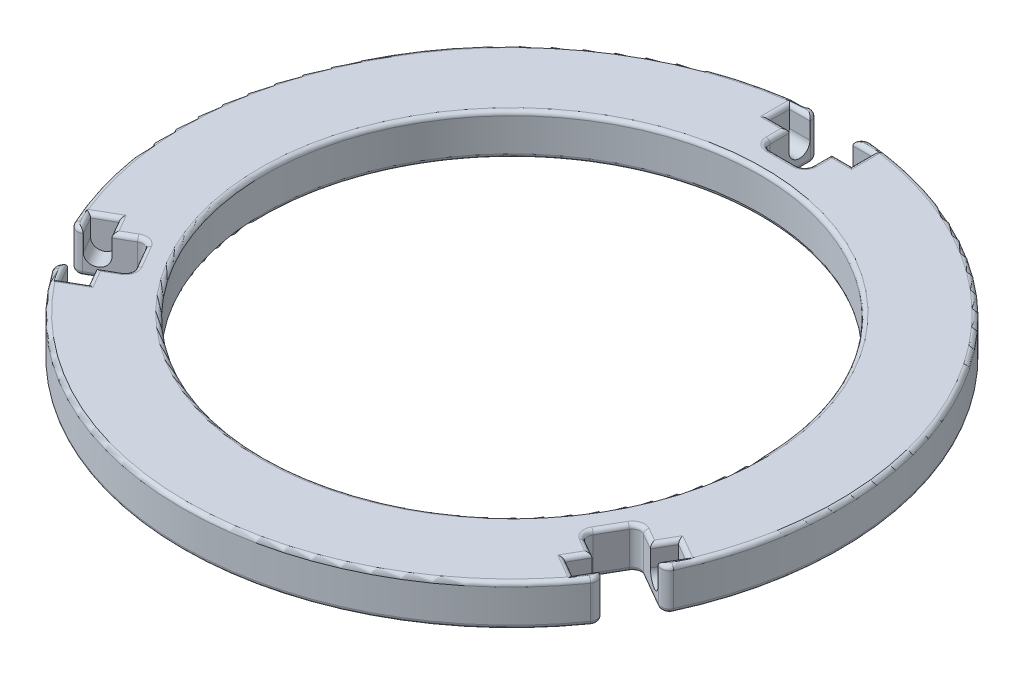
from build123d import *

# Parameters (mm, degrees)
SKETCH1_R           = 60.125027824228184
BOSS_EXTRUDE1_DEPTH = 10
CUT_EXTRUDE2_START  = -5
CUT_EXTRUDE2_DEPTH  = 20.2
CIRPATTERN1_COUNT   = 3
FILLET3_R           = 1


with BuildPart() as part:
    # Sketch1 → Boss-Extrude1 (new body)
    with BuildSketch(Plane(origin=(0, 0, 0), x_dir=(1, 0, 0), z_dir=(0, 1, 0))):
        with BuildLine():
            Line((0, 65.8865619392777), (-3.1999999999999855, 65.8865619392777))
            ThreePointArc((-3.1999999999999855, 65.8865619392777), (-4.614213562373095, 66.4723483769046), (-5.2, 67.88656193927771))
            Line((-5.2, 67.88656193927771), (-5.2, 77.66698140136515))
            ThreePointArc((-5.2, 77.66698140136515), (-5.85263790487315, 79.14502584745443), (-7.384615384615385, 79.65844246293861))
            ThreePointArc((-7.384615384615385, 79.65844246293861), (-69.28203230275511, 39.999999999999964), (-72.67854249111355, -33.433956711215025))
            ThreePointArc((-72.67854249111355, -33.433956711215025), (-71.46792191950811, -34.50397981895536), (-69.86157892883573, -34.33015860100353))
            Line((-69.86157892883573, -34.33015860100353), (-61.39148721500026, -29.439948869959796))
            ThreePointArc((-61.39148721500026, -29.439948869959796), (-59.87384912479522, -29.240148024950535), (-58.659436407431386, -30.17199967752867))
            Line((-58.659436407431386, -30.17199967752867), (-57.05943640743138, -32.94328096963888))
            Line((-57.05943640743138, -32.94328096963888), (-55.459436407431376, -35.71456226174908))
            ThreePointArc((-55.459436407431376, -35.71456226174908), (-55.25963556242212, -37.23220035195412), (-56.19148721500025, -38.446613069317955))
            Line((-56.19148721500025, -38.446613069317955), (-64.66157892883571, -43.336822800361695))
            ThreePointArc((-64.66157892883571, -43.336822800361695), (-65.61528401463497, -44.64104602849913), (-65.29392710649817, -46.224485751723655))
            ThreePointArc((-65.29392710649817, -46.224485751723655), (2.266e-14, -80), (65.2939271064982, -46.224485751723606))
            ThreePointArc((65.2939271064982, -46.224485751723606), (65.615284014635, -44.64104602849908), (64.66157892883574, -43.336822800361645))
            Line((64.66157892883574, -43.336822800361645), (56.19148721500028, -38.44661306931792))
            ThreePointArc((56.19148721500028, -38.44661306931792), (55.25963556242215, -37.23220035195408), (55.45943640743141, -35.71456226174904))
            Line((55.45943640743141, -35.71456226174904), (57.059436407431406, -32.943280969638835))
            Line((57.059436407431406, -32.943280969638835), (58.6594364074314, -30.17199967752863))
            ThreePointArc((58.6594364074314, -30.17199967752863), (59.873849124795235, -29.24014802495049), (61.391487215000275, -29.43994886995975))
            Line((61.391487215000275, -29.43994886995975), (69.86157892883575, -34.33015860100349))
            ThreePointArc((69.86157892883575, -34.33015860100349), (71.46792191950816, -34.50397981895534), (72.67854249111359, -33.433956711214975))
            ThreePointArc((72.67854249111359, -33.433956711214975), (69.28203230275508, 40), (7.384615384615382, 79.65844246293861))
            ThreePointArc((7.384615384615382, 79.65844246293861), (5.852637904873163, 79.14502584745443), (5.2, 77.66698140136516))
            Line((5.2, 77.66698140136516), (5.2, 67.88656193927771))
            ThreePointArc((5.2, 67.88656193927771), (4.614213562373095, 66.4723483769046), (3.1999999999999855, 65.8865619392777))
            Line((3.1999999999999855, 65.8865619392777), (0, 65.8865619392777))
        make_face()
        with Locations(Location((0, 0, 0), (0, 0, 270))):
            Circle(SKETCH1_R, mode=Mode.SUBTRACT)
    extrude(amount=BOSS_EXTRUDE1_DEPTH)

    # Sketch3 → Cut-Extrude2 (cut)
    with BuildSketch(Plane(origin=(-5.2, 0, 0), x_dir=(0, 0, -1), z_dir=(1, 0, 0)).offset(CUT_EXTRUDE2_START)):
        with BuildLine():
            Line((77.55, 10), (77.55, 5))
            ThreePointArc((77.55, 5), (75, 2.450000000000003), (72.45, 4.999999999999999))
            Line((72.45, 4.999999999999999), (72.45, 10))
            Line((72.45, 10), (77.55, 10))
        make_face()
    cut_extrude2 = extrude(amount=CUT_EXTRUDE2_DEPTH, mode=Mode.SUBTRACT)

    # CirPattern1: Cut-Extrude2 ×3 about axis
    cirpattern1_axis = Axis((-4.31e-15, 0, 1.114e-14), (0, 1, 0))
    for i in range(1, CIRPATTERN1_COUNT):
        add(cut_extrude2.rotate(cirpattern1_axis, i * 360 / CIRPATTERN1_COUNT), mode=Mode.SUBTRACT)

    # Fillet3
    # the kernel refuses this fillet: 1 mm, written as the material it takes off along each edge
    with BuildSketch(Plane(origin=(0, 0, 0), x_dir=(-1.8e-16, 0, 1), z_dir=(-1, 0, -1.8e-16))) as fillet3_piece_1:
        with BuildLine():
            CenterArc((60.125027824228184 + FILLET3_R, FILLET3_R), FILLET3_R, 180, 90)
            Line((60.125027824228184, FILLET3_R), (60.125027824228184, 0))
            Line((60.125027824228184, 0), (60.125027824228184 + FILLET3_R, 0))
        make_face()
    revolve(axis=Axis((0, 0, 0), (0, 1, 0)), mode=Mode.SUBTRACT)
    with BuildSketch(Plane(origin=(7.200000000000009, 0, -77.66698140136513), x_dir=(0.09230769230768628, 0, -0.9957305307867332), z_dir=(0.9957305307867332, 0, 0.09230769230768628))) as fillet3_piece_2:
        with BuildLine():
            CenterArc((2.000000000000008 - FILLET3_R, FILLET3_R), FILLET3_R, 270, 90)
            Line((2.000000000000008, FILLET3_R), (2.000000000000008, 0))
            Line((2.000000000000008, 0), (2.000000000000008 - FILLET3_R, 0))
        make_face()
    revolve(axis=Axis((7.200000000000009, 0, -77.66698140136513), (0, 1, 0)), revolution_arc=95.29638091185116, mode=Mode.SUBTRACT)
    with BuildSketch(Plane(origin=(5.2, 0, -77.66698140136516), x_dir=(1, 0, 0), z_dir=(0, 0, 1))) as fillet3_piece_3:
        with BuildLine():
            CenterArc((FILLET3_R, FILLET3_R), FILLET3_R, 180, 90)
            Line((0, FILLET3_R), (0, 0))
            Line((0, 0), (FILLET3_R, 0))
        make_face()
    extrude(amount=9.780419462087451, mode=Mode.SUBTRACT)
    with BuildSketch(Plane(origin=(3.1999999999999913, 0, -67.8865619392777), x_dir=(1, 0, -7.11e-15), z_dir=(-7.11e-15, 0, -1))) as fillet3_piece_4:
        with BuildLine():
            CenterArc((2.0000000000000044 + FILLET3_R, -FILLET3_R), FILLET3_R, 90, 90)
            Line((2.0000000000000044, -FILLET3_R), (2.0000000000000044, 0))
            Line((2.0000000000000044, 0), (2.0000000000000044 + FILLET3_R, 0))
        make_face()
    revolve(axis=Axis((3.1999999999999913, 0, -67.8865619392777), (0, -1, 0)), revolution_arc=90.00000000000057, mode=Mode.SUBTRACT)
    with BuildSketch(Plane(origin=(3.1999999999999855, 0, -65.8865619392777), x_dir=(0, 0, 1), z_dir=(-1, 0, 0))) as fillet3_piece_5:
        with BuildLine():
            CenterArc((FILLET3_R, FILLET3_R), FILLET3_R, 180, 90)
            Line((0, FILLET3_R), (0, 0))
            Line((0, 0), (FILLET3_R, 0))
        make_face()
    extrude(amount=6.399999999999971, mode=Mode.SUBTRACT)
    with BuildSketch(Plane(origin=(-3.1999999999999917, 0, -67.8865619392777), x_dir=(3.11e-15, 0, 1), z_dir=(1, 0, -3.11e-15))) as fillet3_piece_6:
        with BuildLine():
            CenterArc((2 + FILLET3_R, -FILLET3_R), FILLET3_R, 90, 90)
            Line((2, -FILLET3_R), (2, 0))
            Line((2, 0), (2 + FILLET3_R, 0))
        make_face()
    revolve(axis=Axis((-3.1999999999999917, 0, -67.8865619392777), (0, -1, 0)), revolution_arc=90.00000000000058, mode=Mode.SUBTRACT)
    with BuildSketch(Plane(origin=(-5.2, 0, -67.88656193927771), x_dir=(-1, 0, 0), z_dir=(0, 0, -1))) as fillet3_piece_7:
        with BuildLine():
            CenterArc((FILLET3_R, FILLET3_R), FILLET3_R, 180, 90)
            Line((0, FILLET3_R), (0, 0))
            Line((0, 0), (FILLET3_R, 0))
        make_face()
    extrude(amount=9.780419462087437, mode=Mode.SUBTRACT)
    with BuildSketch(Plane(origin=(-7.199999999999994, 0, -77.66698140136515), x_dir=(1, 0, 0), z_dir=(0, 0, 1))) as fillet3_piece_8:
        with BuildLine():
            CenterArc((1.9999999999999947 - FILLET3_R, FILLET3_R), FILLET3_R, 270, 90)
            Line((1.9999999999999947, FILLET3_R), (1.9999999999999947, 0))
            Line((1.9999999999999947, 0), (1.9999999999999947 - FILLET3_R, 0))
        make_face()
    revolve(axis=Axis((-7.199999999999994, 0, -77.66698140136515), (0, 1, 0)), revolution_arc=95.29638091185252, mode=Mode.SUBTRACT)
    with BuildSketch(Plane(origin=(-2.487e-14, 0, -2.354e-14), x_dir=(-0.09230769230769205, 0, -0.9957305307867326), z_dir=(0.9957305307867326, 0, -0.09230769230769205))) as fillet3_piece_9:
        with BuildLine():
            CenterArc((79.99999999999996 - FILLET3_R, FILLET3_R), FILLET3_R, 270, 90)
            Line((79.99999999999996, FILLET3_R), (79.99999999999996, 0))
            Line((79.99999999999996, 0), (79.99999999999996 - FILLET3_R, 0))
        make_face()
    revolve(axis=Axis((-2.487e-14, 0, -2.354e-14), (0, 1, 0)), revolution_arc=109.40723817629542, mode=Mode.SUBTRACT)
    with BuildSketch(Plane(origin=(-70.86157892883571, 0, 32.59810779343464), x_dir=(-0.908481781138918, 0, 0.4179244588901913), z_dir=(-0.4179244588901913, 0, -0.908481781138918))) as fillet3_piece_10:
        with BuildLine():
            CenterArc((1.9999999999999982 - FILLET3_R, FILLET3_R), FILLET3_R, 270, 90)
            Line((2.0000000000000013, FILLET3_R), (1.9999999999999982, 0))
            Line((1.9999999999999982, 0), (1.9999999999999982 - FILLET3_R, 0))
        make_face()
    revolve(axis=Axis((-70.86157892883571, 0, 32.59810779343464), (0, 1, 0)), revolution_arc=95.29638091185156, mode=Mode.SUBTRACT)
    with BuildSketch(Plane(origin=(-69.86157892883573, 0, 34.33015860100353), x_dir=(-0.5000000000000009, 0, -0.8660254037844382), z_dir=(0.8660254037844382, 0, -0.5000000000000009))) as fillet3_piece_11:
        with BuildLine():
            CenterArc((FILLET3_R, FILLET3_R), FILLET3_R, 180, 90)
            Line((0, FILLET3_R), (0, 0))
            Line((0, 0), (FILLET3_R, 0))
        make_face()
    extrude(amount=9.780419462087455, mode=Mode.SUBTRACT)
    with BuildSketch(Plane(origin=(-60.39148721500026, 0, 31.171999677528664), x_dir=(-0.5000000000000021, 0, -0.8660254037844375), z_dir=(-0.8660254037844375, 0, 0.5000000000000021))) as fillet3_piece_12:
        with BuildLine():
            CenterArc((1.999999999999992 + FILLET3_R, -FILLET3_R), FILLET3_R, 90, 90)
            Line((1.999999999999992, -FILLET3_R), (1.999999999999992, 0))
            Line((1.999999999999992, 0), (1.999999999999992 + FILLET3_R, 0))
        make_face()
    revolve(axis=Axis((-60.39148721500026, 0, 31.171999677528664), (0, -1, 0)), revolution_arc=90.0000000000003, mode=Mode.SUBTRACT)
    with BuildSketch(Plane(origin=(-58.659436407431386, 0, 30.17199967752867), x_dir=(0.866025403784438, 0, -0.5000000000000011), z_dir=(0.500000000000001, 0, 0.866025403784438))) as fillet3_piece_13:
        with BuildLine():
            CenterArc((FILLET3_R, FILLET3_R), FILLET3_R, 180, 90)
            Line((0, FILLET3_R), (0, 0))
            Line((0, 0), (FILLET3_R, 0))
        make_face()
    extrude(amount=6.400000000000007, mode=Mode.SUBTRACT)
    with BuildSketch(Plane(origin=(-57.191487215000265, 0, 36.71456226174908), x_dir=(0.8660254037844402, 0, -0.49999999999999745), z_dir=(-0.49999999999999745, 0, -0.8660254037844402))) as fillet3_piece_14:
        with BuildLine():
            CenterArc((2.00000000000001 + FILLET3_R, -FILLET3_R), FILLET3_R, 90, 90)
            Line((2.00000000000001, -FILLET3_R), (2.00000000000001, 0))
            Line((2.00000000000001, 0), (2.00000000000001 + FILLET3_R, 0))
        make_face()
    revolve(axis=Axis((-57.191487215000265, 0, 36.71456226174908), (0, -1, 0)), revolution_arc=89.99999999999945, mode=Mode.SUBTRACT)
    with BuildSketch(Plane(origin=(-56.19148721500025, 0, 38.446613069317955), x_dir=(0.5000000000000016, 0, 0.8660254037844378), z_dir=(-0.8660254037844377, 0, 0.5000000000000014))) as fillet3_piece_15:
        with BuildLine():
            CenterArc((FILLET3_R, FILLET3_R), FILLET3_R, 180, 90)
            Line((0, FILLET3_R), (0, 0))
            Line((0, 0), (FILLET3_R, 0))
        make_face()
    extrude(amount=9.78041946208745, mode=Mode.SUBTRACT)
    with BuildSketch(Plane(origin=(-63.661578928835745, 0, 45.06887360793058), x_dir=(-0.4999999999999872, 0, -0.866025403784446), z_dir=(0.866025403784446, 0, -0.4999999999999872))) as fillet3_piece_16:
        with BuildLine():
            CenterArc((1.9999999999999802 - FILLET3_R, FILLET3_R), FILLET3_R, 270, 90)
            Line((1.9999999999999802 - FILLET3_R, -1.1e-16), (1.9999999999999802, 0))
            Line((1.9999999999999802, 0), (1.9999999999999802, FILLET3_R))
        make_face()
    revolve(axis=Axis((-63.661578928835745, 0, 45.06887360793058), (0, 1, 0)), revolution_arc=95.29638091185342, mode=Mode.SUBTRACT)
    with BuildSketch(Plane(origin=(0, 0, 3.55e-15), x_dir=(-0.8161740888312272, 0, 0.5778060718965456), z_dir=(-0.5778060718965456, 0, -0.8161740888312272))) as fillet3_piece_17:
        with BuildLine():
            CenterArc((80 - FILLET3_R, FILLET3_R), FILLET3_R, 270, 90)
            Line((80 - FILLET3_R, -1.1e-16), (80, 0))
            Line((80, 0), (80, FILLET3_R))
        make_face()
    revolve(axis=Axis((0, 0, 3.55e-15), (0, 1, 0)), revolution_arc=109.40723817629534, mode=Mode.SUBTRACT)
    with BuildSketch(Plane(origin=(63.66157892883577, 0, 45.06887360793052), x_dir=(0.8161740888312243, 0, 0.5778060718965496), z_dir=(-0.5778060718965496, 0, 0.8161740888312243))) as fillet3_piece_18:
        with BuildLine():
            CenterArc((1.999999999999976 - FILLET3_R, FILLET3_R), FILLET3_R, 270, 90)
            Line((1.999999999999976 - FILLET3_R, -1.1e-16), (1.999999999999976, 0))
            Line((1.999999999999976, 0), (1.99999999999998, FILLET3_R))
        make_face()
    revolve(axis=Axis((63.66157892883577, 0, 45.06887360793052), (0, 1, 0)), revolution_arc=95.29638091185348, mode=Mode.SUBTRACT)
    with BuildSketch(Plane(origin=(64.66157892883574, 0, 43.336822800361645), x_dir=(-0.5000000000000004, 0, 0.8660254037844385), z_dir=(-0.8660254037844385, 0, -0.5000000000000004))) as fillet3_piece_19:
        with BuildLine():
            CenterArc((FILLET3_R, FILLET3_R), FILLET3_R, 180, 90)
            Line((0, FILLET3_R), (0, 0))
            Line((0, 0), (FILLET3_R, 0))
        make_face()
    extrude(amount=9.780419462087444, mode=Mode.SUBTRACT)
    with BuildSketch(Plane(origin=(57.19148721500029, 0, 36.714562261749045), x_dir=(-0.5000000000000059, 0, 0.8660254037844354), z_dir=(0.8660254037844354, 0, 0.5000000000000059))) as fillet3_piece_20:
        with BuildLine():
            CenterArc((2.0000000000000053 + FILLET3_R, -FILLET3_R), FILLET3_R, 90, 90)
            Line((2.0000000000000053, -FILLET3_R), (2.0000000000000053, 0))
            Line((2.0000000000000053, 0), (2.0000000000000053 + FILLET3_R, 0))
        make_face()
    revolve(axis=Axis((57.19148721500029, 0, 36.714562261749045), (0, -1, 0)), revolution_arc=89.99999999999972, mode=Mode.SUBTRACT)
    with BuildSketch(Plane(origin=(55.45943640743141, 0, 35.71456226174904), x_dir=(-0.8660254037844395, 0, -0.49999999999999856), z_dir=(0.49999999999999856, 0, -0.8660254037844395))) as fillet3_piece_21:
        with BuildLine():
            CenterArc((FILLET3_R, FILLET3_R), FILLET3_R, 180, 90)
            Line((0, FILLET3_R), (0, 0))
            Line((0, 0), (FILLET3_R, 0))
        make_face()
    extrude(amount=6.399999999999996, mode=Mode.SUBTRACT)
    with BuildSketch(Plane(origin=(60.391487215000275, 0, 31.171999677528618), x_dir=(-0.8660254037844407, 0, -0.4999999999999965), z_dir=(-0.4999999999999965, 0, 0.8660254037844407))) as fillet3_piece_22:
        with BuildLine():
            CenterArc((1.9999999999999927 + FILLET3_R, -FILLET3_R), FILLET3_R, 90, 90)
            Line((1.9999999999999927, -FILLET3_R), (1.9999999999999927, 0))
            Line((1.9999999999999927, 0), (1.9999999999999927 + FILLET3_R, 0))
        make_face()
    revolve(axis=Axis((60.391487215000275, 0, 31.171999677528618), (0, -1, 0)), revolution_arc=90.00000000000038, mode=Mode.SUBTRACT)
    with BuildSketch(Plane(origin=(61.391487215000275, 0, 29.43994886995975), x_dir=(0.5000000000000006, 0, -0.8660254037844384), z_dir=(0.8660254037844384, 0, 0.5000000000000006))) as fillet3_piece_23:
        with BuildLine():
            CenterArc((FILLET3_R, FILLET3_R), FILLET3_R, 180, 90)
            Line((0, FILLET3_R), (0, 0))
            Line((0, 0), (FILLET3_R, 0))
        make_face()
    extrude(amount=9.78041946208747, mode=Mode.SUBTRACT)
    with BuildSketch(Plane(origin=(70.86157892883575, 0, 32.59810779343464), x_dir=(-0.5000000000000067, 0, 0.8660254037844348), z_dir=(-0.8660254037844348, 0, -0.5000000000000067))) as fillet3_piece_24:
        with BuildLine():
            CenterArc((1.9999999999999734 - FILLET3_R, FILLET3_R), FILLET3_R, 270, 90)
            Line((1.9999999999999734, FILLET3_R), (1.9999999999999734, 0))
            Line((1.9999999999999734, 0), (1.9999999999999734 - FILLET3_R, 0))
        make_face()
    revolve(axis=Axis((70.86157892883575, 0, 32.59810779343464), (0, 1, 0)), revolution_arc=95.29638091185382, mode=Mode.SUBTRACT)
    with BuildSketch(Plane(origin=(1.066e-14, 0, -2.89e-15), x_dir=(0.9084817811389199, 0, 0.41792445889018726), z_dir=(-0.41792445889018726, 0, 0.9084817811389199))) as fillet3_piece_25:
        with BuildLine():
            CenterArc((80 - FILLET3_R, FILLET3_R), FILLET3_R, 270, 89.99999999999999)
            Line((80, FILLET3_R), (80, 0))
            Line((80, 0), (80 - FILLET3_R, 0))
        make_face()
    revolve(axis=Axis((1.066e-14, 0, -2.89e-15), (0, 1, 0)), revolution_arc=109.40723817629535, mode=Mode.SUBTRACT)
    with BuildSketch(Plane(origin=(-62.060270063483244, 10, 47.608459118601274), x_dir=(-0.8660254037844388, 0, 0.4999999999999998), z_dir=(-0.49999999999999983, 0, -0.8660254037844388))) as fillet3_piece_26:
        with BuildLine():
            CenterArc((FILLET3_R, -FILLET3_R), FILLET3_R, 90, 90)
            Line((0, -FILLET3_R), (0, 0))
            Line((0, 0), (FILLET3_R, 0))
        make_face()
    extrude(amount=7.499999999999949, mode=Mode.SUBTRACT)
    with BuildSketch(Plane(origin=(-68.51027006348322, 10, 36.436731409782055), x_dir=(-0.8660254037844388, 0, 0.4999999999999998), z_dir=(-0.49999999999999983, 0, -0.8660254037844388))) as fillet3_piece_27:
        with BuildLine():
            CenterArc((FILLET3_R, -FILLET3_R), FILLET3_R, 90, 90)
            Line((0, -FILLET3_R), (0, 0))
            Line((0, 0), (FILLET3_R, 0))
        make_face()
    extrude(amount=7.300000000000049, mode=Mode.SUBTRACT)
    with BuildSketch(Plane(origin=(-70.86157892883571, 10, 32.59810779343464), x_dir=(-0.908481781138918, 0, 0.4179244588901913), z_dir=(-0.4179244588901913, 0, -0.908481781138918))) as fillet3_piece_28:
        with BuildLine():
            CenterArc((1.9999999999999982 - FILLET3_R, -FILLET3_R), FILLET3_R, 0, 90)
            Line((2.0000000000000013, -FILLET3_R), (1.9999999999999982, 0))
            Line((1.9999999999999982, 0), (1.9999999999999982 - FILLET3_R, 0))
        make_face()
    revolve(axis=Axis((-70.86157892883571, 10, 32.59810779343464), (0, 1, 0)), revolution_arc=95.29638091185156, mode=Mode.SUBTRACT)
    with BuildSketch(Plane(origin=(-2.487e-14, 10, -2.354e-14), x_dir=(-0.09230769230769205, 0, -0.9957305307867326), z_dir=(0.9957305307867326, 0, -0.09230769230769205))) as fillet3_piece_29:
        with BuildLine():
            CenterArc((79.99999999999996 - FILLET3_R, -FILLET3_R), FILLET3_R, 0, 90)
            Line((79.99999999999996, -FILLET3_R), (79.99999999999996, 0))
            Line((79.99999999999996, 0), (79.99999999999996 - FILLET3_R, 0))
        make_face()
    revolve(axis=Axis((-2.487e-14, 10, -2.354e-14), (0, 1, 0)), revolution_arc=109.40723817629542, mode=Mode.SUBTRACT)
    with BuildSketch(Plane(origin=(-7.199999999999994, 10, -77.66698140136515), x_dir=(1, 0, 0), z_dir=(0, 0, 1))) as fillet3_piece_30:
        with BuildLine():
            CenterArc((1.9999999999999947 - FILLET3_R, -FILLET3_R), FILLET3_R, 0, 90)
            Line((1.9999999999999947, -FILLET3_R), (1.9999999999999947, 0))
            Line((1.9999999999999947, 0), (1.9999999999999947 - FILLET3_R, 0))
        make_face()
    revolve(axis=Axis((-7.199999999999994, 10, -77.66698140136515), (0, 1, 0)), revolution_arc=95.29638091185252, mode=Mode.SUBTRACT)
    with BuildSketch(Plane(origin=(-10.2, 10, -77.55), x_dir=(0, 0, -1), z_dir=(1, 0, 0))) as fillet3_piece_31:
        with BuildLine():
            CenterArc((FILLET3_R, -FILLET3_R), FILLET3_R, 90, 90)
            Line((0, -FILLET3_R), (0, 0))
            Line((0, 0), (FILLET3_R, 0))
        make_face()
    extrude(amount=7.499999999999998, mode=Mode.SUBTRACT)
    with BuildSketch(Plane(origin=(-10.2, 10, -72.45), x_dir=(-1, 0, 0), z_dir=(0, 0, -1))) as fillet3_piece_32:
        with BuildLine():
            CenterArc((FILLET3_R, -FILLET3_R), FILLET3_R, 90, 90)
            Line((0, -FILLET3_R), (0, 0))
            Line((0, 0), (FILLET3_R, 0))
        make_face()
    extrude(amount=5.099999999999994, mode=Mode.SUBTRACT)
    with BuildSketch(Plane(origin=(-10.2, 10, -72.45), x_dir=(0, 0, 1), z_dir=(1, 0, 0))) as fillet3_piece_33:
        with BuildLine():
            CenterArc((FILLET3_R, FILLET3_R), FILLET3_R, 180, 90)
            Line((0, FILLET3_R), (0, 0))
            Line((0, 0), (FILLET3_R, 0))
        make_face()
    extrude(amount=7.499999999999998, mode=Mode.SUBTRACT)
    with BuildSketch(Plane(origin=(-5.2, 10, -67.88656193927771), x_dir=(-1, 0, 0), z_dir=(0, 0, -1)), Plane(origin=(5.2, 10, -74.95), x_dir=(1, 0, 0), z_dir=(0, 0, 1))) as fillet3_piece_34:
        with BuildLine():
            CenterArc((FILLET3_R, -FILLET3_R), FILLET3_R, 90, 90)
            Line((0, -FILLET3_R), (0, 0))
            Line((0, 0), (FILLET3_R, 0))
        make_face()
    extrude(amount=7.063438060722291, mode=Mode.SUBTRACT)
    with BuildSketch(Plane(origin=(-3.1999999999999917, 10, -67.8865619392777), x_dir=(3.11e-15, 0, 1), z_dir=(1, 0, -3.11e-15))) as fillet3_piece_35:
        with BuildLine():
            CenterArc((2 + FILLET3_R, FILLET3_R), FILLET3_R, 180, 90)
            Line((2, FILLET3_R), (2, 0))
            Line((2, 0), (2 + FILLET3_R, 0))
        make_face()
    revolve(axis=Axis((-3.1999999999999917, 10, -67.8865619392777), (0, -1, 0)), revolution_arc=90.00000000000058, mode=Mode.SUBTRACT)
    with BuildSketch(Plane(origin=(-3.1999999999999855, 10, -65.8865619392777), x_dir=(0, 0, 1), z_dir=(1, 0, 0))) as fillet3_piece_36:
        with BuildLine():
            CenterArc((FILLET3_R, FILLET3_R), FILLET3_R, 180, 90)
            Line((0, FILLET3_R), (0, 0))
            Line((0, 0), (FILLET3_R, 0))
        make_face()
    extrude(amount=6.399999999999971, mode=Mode.SUBTRACT)
    with BuildSketch(Plane(origin=(3.1999999999999913, 10, -67.8865619392777), x_dir=(1, 0, -7.11e-15), z_dir=(-7.11e-15, 0, -1))) as fillet3_piece_37:
        with BuildLine():
            CenterArc((2.0000000000000044 + FILLET3_R, FILLET3_R), FILLET3_R, 180, 90)
            Line((2.0000000000000044, FILLET3_R), (2.0000000000000044, 0))
            Line((2.0000000000000044, 0), (2.0000000000000044 + FILLET3_R, 0))
        make_face()
    revolve(axis=Axis((3.1999999999999913, 10, -67.8865619392777), (0, -1, 0)), revolution_arc=90.00000000000057, mode=Mode.SUBTRACT)
    with BuildSketch(Plane(origin=(2.6999999999999993, 10, -72.45), x_dir=(0, 0, 1), z_dir=(1, 0, 0))) as fillet3_piece_38:
        with BuildLine():
            CenterArc((FILLET3_R, FILLET3_R), FILLET3_R, 180, 90)
            Line((0, FILLET3_R), (0, 0))
            Line((0, 0), (FILLET3_R, 0))
        make_face()
    extrude(amount=7.300000000000001, mode=Mode.SUBTRACT)
    with BuildSketch(Plane(origin=(10, 10, -72.45), x_dir=(1, 0, 0), z_dir=(0, 0, -1))) as fillet3_piece_39:
        with BuildLine():
            CenterArc((FILLET3_R, FILLET3_R), FILLET3_R, 180, 90)
            Line((0, FILLET3_R), (0, 0))
            Line((0, 0), (FILLET3_R, 0))
        make_face()
    extrude(amount=5.099999999999994, mode=Mode.SUBTRACT)
    with BuildSketch(Plane(origin=(2.6999999999999993, 10, -77.55), x_dir=(0, 0, -1), z_dir=(1, 0, 0))) as fillet3_piece_40:
        with BuildLine():
            CenterArc((FILLET3_R, -FILLET3_R), FILLET3_R, 90, 90)
            Line((0, -FILLET3_R), (0, 0))
            Line((0, 0), (FILLET3_R, 0))
        make_face()
    extrude(amount=7.300000000000001, mode=Mode.SUBTRACT)
    with BuildSketch(Plane(origin=(7.200000000000009, 10, -77.66698140136513), x_dir=(0.09230769230768628, 0, -0.9957305307867332), z_dir=(0.9957305307867332, 0, 0.09230769230768628))) as fillet3_piece_41:
        with BuildLine():
            CenterArc((2.000000000000008 - FILLET3_R, -FILLET3_R), FILLET3_R, 0, 90)
            Line((2.000000000000008, -FILLET3_R), (2.000000000000008, 0))
            Line((2.000000000000008, 0), (2.000000000000008 - FILLET3_R, 0))
        make_face()
    revolve(axis=Axis((7.200000000000009, 10, -77.66698140136513), (0, 1, 0)), revolution_arc=95.29638091185116, mode=Mode.SUBTRACT)
    with BuildSketch(Plane(origin=(1.066e-14, 10, -2.89e-15), x_dir=(0.9084817811389199, 0, 0.41792445889018726), z_dir=(-0.41792445889018726, 0, 0.9084817811389199))) as fillet3_piece_42:
        with BuildLine():
            CenterArc((80 - FILLET3_R, -FILLET3_R), FILLET3_R, 0, 90)
            Line((80, -FILLET3_R), (80, 0))
            Line((80, 0), (80 - FILLET3_R, 0))
        make_face()
    revolve(axis=Axis((1.066e-14, 10, -2.89e-15), (0, 1, 0)), revolution_arc=109.40723817629535, mode=Mode.SUBTRACT)
    with BuildSketch(Plane(origin=(70.86157892883575, 10, 32.59810779343464), x_dir=(-0.5000000000000067, 0, 0.8660254037844348), z_dir=(-0.8660254037844348, 0, -0.5000000000000067))) as fillet3_piece_43:
        with BuildLine():
            CenterArc((1.9999999999999734 - FILLET3_R, -FILLET3_R), FILLET3_R, 0, 90)
            Line((1.9999999999999734, -FILLET3_R), (1.9999999999999734, 0))
            Line((1.9999999999999734, 0), (1.9999999999999734 - FILLET3_R, 0))
        make_face()
    revolve(axis=Axis((70.86157892883575, 10, 32.59810779343464), (0, 1, 0)), revolution_arc=95.29638091185382, mode=Mode.SUBTRACT)
    with BuildSketch(Plane(origin=(65.81027006348323, 10, 41.11326859021798), x_dir=(0.8660254037844384, 0, 0.5000000000000004), z_dir=(-0.5000000000000004, 0, 0.8660254037844384))) as fillet3_piece_44:
        with BuildLine():
            CenterArc((FILLET3_R, -FILLET3_R), FILLET3_R, 90, 90)
            Line((0, -FILLET3_R), (0, 0))
            Line((0, 0), (FILLET3_R, 0))
        make_face()
    extrude(amount=7.300000000000071, mode=Mode.SUBTRACT)
    with BuildSketch(Plane(origin=(72.2602700634832, 10, 29.941540881398787), x_dir=(0.8660254037844384, 0, 0.5000000000000004), z_dir=(-0.5000000000000004, 0, 0.8660254037844384))) as fillet3_piece_45:
        with BuildLine():
            CenterArc((FILLET3_R, -FILLET3_R), FILLET3_R, 90, 90)
            Line((-1.78e-15, -FILLET3_R), (0, 0))
            Line((0, 0), (FILLET3_R, 0))
        make_face()
    extrude(amount=7.499999999999931, mode=Mode.SUBTRACT)
    with BuildSketch(Plane(origin=(67.84354050418257, 10, 27.391540881398786), x_dir=(0.5000000000000006, 0, -0.8660254037844385), z_dir=(0.8660254037844384, 0, 0.5000000000000004))) as fillet3_piece_46:
        with BuildLine():
            CenterArc((FILLET3_R, -FILLET3_R), FILLET3_R, 90, 90)
            Line((-2.12e-15, -FILLET3_R), (0, 0))
            Line((0, 0), (FILLET3_R, 0))
        make_face()
    extrude(amount=5.099999999999996, mode=Mode.SUBTRACT)
    with BuildSketch(Plane(origin=(61.3935405041826, 10, 38.56326859021798), x_dir=(-0.8660254037844384, 0, -0.5000000000000004), z_dir=(-0.5000000000000004, 0, 0.8660254037844384))) as fillet3_piece_47:
        with BuildLine():
            CenterArc((FILLET3_R, FILLET3_R), FILLET3_R, 180, 90)
            Line((3.55e-15, FILLET3_R), (0, 0))
            Line((0, 0), (FILLET3_R, 0))
        make_face()
    extrude(amount=7.300000000000071, mode=Mode.SUBTRACT)
    with BuildSketch(Plane(origin=(67.84354050418257, 10, 27.39154088139879), x_dir=(-0.8660254037844384, 0, -0.5000000000000004), z_dir=(-0.5000000000000004, 0, 0.8660254037844384))) as fillet3_piece_48:
        with BuildLine():
            CenterArc((FILLET3_R, FILLET3_R), FILLET3_R, 180, 90)
            Line((-1.78e-15, FILLET3_R), (0, 0))
            Line((0, 0), (FILLET3_R, 0))
        make_face()
    extrude(amount=7.4999999999999245, mode=Mode.SUBTRACT)
    with BuildSketch(Plane(origin=(61.391487215000275, 10, 29.43994886995975), x_dir=(0.5000000000000006, 0, -0.8660254037844384), z_dir=(0.8660254037844384, 0, 0.5000000000000006))) as fillet3_piece_49:
        with BuildLine():
            CenterArc((FILLET3_R, -FILLET3_R), FILLET3_R, 90, 90)
            Line((0, -FILLET3_R), (0, 0))
            Line((0, 0), (FILLET3_R, 0))
        make_face()
    extrude(amount=7.06343806072232, mode=Mode.SUBTRACT)
    with BuildSketch(Plane(origin=(60.391487215000275, 10, 31.171999677528618), x_dir=(-0.8660254037844407, 0, -0.4999999999999965), z_dir=(-0.4999999999999965, 0, 0.8660254037844407))) as fillet3_piece_50:
        with BuildLine():
            CenterArc((1.9999999999999927 + FILLET3_R, FILLET3_R), FILLET3_R, 180, 90)
            Line((1.9999999999999927, FILLET3_R), (1.9999999999999927, 0))
            Line((1.9999999999999927, 0), (1.9999999999999927 + FILLET3_R, 0))
        make_face()
    revolve(axis=Axis((60.391487215000275, 10, 31.171999677528618), (0, -1, 0)), revolution_arc=90.00000000000038, mode=Mode.SUBTRACT)
    with BuildSketch(Plane(origin=(58.6594364074314, 10, 30.17199967752863), x_dir=(-0.8660254037844395, 0, -0.49999999999999856), z_dir=(-0.49999999999999856, 0, 0.8660254037844395))) as fillet3_piece_51:
        with BuildLine():
            CenterArc((FILLET3_R, FILLET3_R), FILLET3_R, 180, 90)
            Line((1.78e-15, FILLET3_R), (0, 0))
            Line((0, 0), (FILLET3_R, 0))
        make_face()
    extrude(amount=6.399999999999996, mode=Mode.SUBTRACT)
    with BuildSketch(Plane(origin=(57.19148721500029, 10, 36.714562261749045), x_dir=(-0.5000000000000059, 0, 0.8660254037844354), z_dir=(0.8660254037844354, 0, 0.5000000000000059))) as fillet3_piece_52:
        with BuildLine():
            CenterArc((2.0000000000000053 + FILLET3_R, FILLET3_R), FILLET3_R, 180, 90)
            Line((2.0000000000000053, FILLET3_R), (2.0000000000000053, 0))
            Line((2.0000000000000053, 0), (2.0000000000000053 + FILLET3_R, 0))
        make_face()
    revolve(axis=Axis((57.19148721500029, 10, 36.714562261749045), (0, -1, 0)), revolution_arc=89.99999999999972, mode=Mode.SUBTRACT)
    with BuildSketch(Plane(origin=(62.308604013643695, 10, 41.97833209967908), x_dir=(-0.5000000000000004, 0, 0.8660254037844385), z_dir=(-0.8660254037844385, 0, -0.5000000000000004))) as fillet3_piece_53:
        with BuildLine():
            CenterArc((FILLET3_R, -FILLET3_R), FILLET3_R, 90, 90)
            Line((3.55e-15, -FILLET3_R), (0, 0))
            Line((0, 0), (FILLET3_R, 0))
        make_face()
    extrude(amount=7.0634380607223175, mode=Mode.SUBTRACT)
    with BuildSketch(Plane(origin=(57.74354050418256, 10, 44.88525403784444), x_dir=(-0.5000000000000004, 0, 0.8660254037844384), z_dir=(0.8660254037844384, 0, 0.5000000000000004))) as fillet3_piece_54:
        with BuildLine():
            CenterArc((FILLET3_R, FILLET3_R), FILLET3_R, 180, 90)
            Line((2.6e-15, FILLET3_R), (0, 0))
            Line((0, 0), (FILLET3_R, 0))
        make_face()
    extrude(amount=5.099999999999996, mode=Mode.SUBTRACT)
    with BuildSketch(Plane(origin=(63.66157892883577, 10, 45.06887360793052), x_dir=(0.8161740888312243, 0, 0.5778060718965496), z_dir=(-0.5778060718965496, 0, 0.8161740888312243))) as fillet3_piece_55:
        with BuildLine():
            CenterArc((1.999999999999976 - FILLET3_R, -FILLET3_R), FILLET3_R, 0, 90)
            Line((1.999999999999976 - FILLET3_R, 0), (1.999999999999976, 0))
            Line((1.999999999999976, 0), (1.99999999999998, -FILLET3_R))
        make_face()
    revolve(axis=Axis((63.66157892883577, 10, 45.06887360793052), (0, 1, 0)), revolution_arc=95.29638091185348, mode=Mode.SUBTRACT)
    with BuildSketch(Plane(origin=(0, 10, 3.55e-15), x_dir=(-0.8161740888312272, 0, 0.5778060718965456), z_dir=(-0.5778060718965456, 0, -0.8161740888312272))) as fillet3_piece_56:
        with BuildLine():
            CenterArc((80 - FILLET3_R, -FILLET3_R), FILLET3_R, 0, 90)
            Line((80 - FILLET3_R, 0), (80, 0))
            Line((80, 0), (80, -FILLET3_R))
        make_face()
    revolve(axis=Axis((0, 10, 3.55e-15), (0, 1, 0)), revolution_arc=109.40723817629534, mode=Mode.SUBTRACT)
    with BuildSketch(Plane(origin=(-63.661578928835745, 10, 45.06887360793058), x_dir=(-0.4999999999999872, 0, -0.866025403784446), z_dir=(0.866025403784446, 0, -0.4999999999999872))) as fillet3_piece_57:
        with BuildLine():
            CenterArc((1.9999999999999802 - FILLET3_R, -FILLET3_R), FILLET3_R, 0, 90)
            Line((1.9999999999999802 - FILLET3_R, 0), (1.9999999999999802, 0))
            Line((1.9999999999999802, 0), (1.9999999999999802, -FILLET3_R))
        make_face()
    revolve(axis=Axis((-63.661578928835745, 10, 45.06887360793058), (0, 1, 0)), revolution_arc=95.29638091185342, mode=Mode.SUBTRACT)
    with BuildSketch(Plane(origin=(-57.64354050418261, 10, 45.05845911860128), x_dir=(0.4999999999999999, 0, 0.8660254037844388), z_dir=(-0.8660254037844388, 0, 0.49999999999999983))) as fillet3_piece_58:
        with BuildLine():
            CenterArc((FILLET3_R, -FILLET3_R), FILLET3_R, 90, 90)
            Line((3.55e-15, -FILLET3_R), (0, 0))
            Line((0, 0), (FILLET3_R, 0))
        make_face()
    extrude(amount=5.099999999999997, mode=Mode.SUBTRACT)
    with BuildSketch(Plane(origin=(-64.09354050418258, 10, 33.88673140978205), x_dir=(0.8660254037844388, 0, -0.4999999999999998), z_dir=(-0.49999999999999983, 0, -0.8660254037844388))) as fillet3_piece_59:
        with BuildLine():
            CenterArc((FILLET3_R, FILLET3_R), FILLET3_R, 180, 90)
            Line((0, FILLET3_R), (0, 0))
            Line((0, 0), (FILLET3_R, 0))
        make_face()
    extrude(amount=7.3000000000000425, mode=Mode.SUBTRACT)
    with BuildSketch(Plane(origin=(-57.64354050418261, 10, 45.05845911860128), x_dir=(0.8660254037844388, 0, -0.4999999999999998), z_dir=(-0.49999999999999983, 0, -0.8660254037844388))) as fillet3_piece_60:
        with BuildLine():
            CenterArc((FILLET3_R, FILLET3_R), FILLET3_R, 180, 90)
            Line((0, FILLET3_R), (0, 0))
            Line((0, 0), (FILLET3_R, 0))
        make_face()
    extrude(amount=7.499999999999949, mode=Mode.SUBTRACT)
    with BuildSketch(Plane(origin=(-56.19148721500025, 10, 38.446613069317955), x_dir=(0.5000000000000016, 0, 0.8660254037844378), z_dir=(-0.8660254037844377, 0, 0.5000000000000014))) as fillet3_piece_61:
        with BuildLine():
            CenterArc((FILLET3_R, -FILLET3_R), FILLET3_R, 90, 90)
            Line((0, -FILLET3_R), (0, 0))
            Line((0, 0), (FILLET3_R, 0))
        make_face()
    extrude(amount=7.063438060722339, mode=Mode.SUBTRACT)
    with BuildSketch(Plane(origin=(-57.191487215000265, 10, 36.71456226174908), x_dir=(0.8660254037844402, 0, -0.49999999999999745), z_dir=(-0.49999999999999745, 0, -0.8660254037844402))) as fillet3_piece_62:
        with BuildLine():
            CenterArc((2.00000000000001 + FILLET3_R, FILLET3_R), FILLET3_R, 180, 90)
            Line((2.00000000000001, FILLET3_R), (2.00000000000001, 0))
            Line((2.00000000000001, 0), (2.00000000000001 + FILLET3_R, 0))
        make_face()
    revolve(axis=Axis((-57.191487215000265, 10, 36.71456226174908), (0, -1, 0)), revolution_arc=89.99999999999945, mode=Mode.SUBTRACT)
    with BuildSketch(Plane(origin=(-55.459436407431376, 10, 35.71456226174908), x_dir=(0.866025403784438, 0, -0.5000000000000011), z_dir=(-0.500000000000001, 0, -0.866025403784438))) as fillet3_piece_63:
        with BuildLine():
            CenterArc((FILLET3_R, FILLET3_R), FILLET3_R, 180, 90)
            Line((6.15e-15, FILLET3_R), (0, 0))
            Line((0, 0), (FILLET3_R, 0))
        make_face()
    extrude(amount=6.400000000000007, mode=Mode.SUBTRACT)
    with BuildSketch(Plane(origin=(-60.39148721500026, 10, 31.171999677528664), x_dir=(-0.5000000000000021, 0, -0.8660254037844375), z_dir=(-0.8660254037844375, 0, 0.5000000000000021))) as fillet3_piece_64:
        with BuildLine():
            CenterArc((1.999999999999992 + FILLET3_R, FILLET3_R), FILLET3_R, 180, 90)
            Line((1.999999999999992, FILLET3_R), (1.999999999999992, 0))
            Line((1.999999999999992, 0), (1.999999999999992 + FILLET3_R, 0))
        make_face()
    revolve(axis=Axis((-60.39148721500026, 10, 31.171999677528664), (0, -1, 0)), revolution_arc=90.0000000000003, mode=Mode.SUBTRACT)
    with BuildSketch(Plane(origin=(-67.50860401364368, 10, 32.971667900320966), x_dir=(-0.5000000000000009, 0, -0.8660254037844382), z_dir=(0.8660254037844382, 0, -0.5000000000000009))) as fillet3_piece_65:
        with BuildLine():
            CenterArc((FILLET3_R, -FILLET3_R), FILLET3_R, 90, 90)
            Line((0, -FILLET3_R), (0, 0))
            Line((0, 0), (FILLET3_R, 0))
        make_face()
    extrude(amount=7.063438060722322, mode=Mode.SUBTRACT)
    with BuildSketch(Plane(origin=(-67.7435405041826, 10, 27.564745962155616), x_dir=(-0.4999999999999998, 0, -0.8660254037844388), z_dir=(-0.8660254037844388, 0, 0.49999999999999983))) as fillet3_piece_66:
        with BuildLine():
            CenterArc((FILLET3_R, FILLET3_R), FILLET3_R, 180, 90)
            Line((0, FILLET3_R), (0, 0))
            Line((0, 0), (FILLET3_R, 0))
        make_face()
    extrude(amount=5.099999999999997, mode=Mode.SUBTRACT)
    with BuildSketch(Plane(origin=(0, 10, 0), x_dir=(-1.8e-16, 0, 1), z_dir=(-1, 0, -1.8e-16))) as fillet3_piece_67:
        with BuildLine():
            CenterArc((60.125027824228184 + FILLET3_R, -FILLET3_R), FILLET3_R, 90, 90)
            Line((60.125027824228184, -FILLET3_R), (60.125027824228184, 0))
            Line((60.125027824228184, 0), (60.125027824228184 + FILLET3_R, 0))
        make_face()
    revolve(axis=Axis((0, 10, 0), (0, 1, 0)), mode=Mode.SUBTRACT)
    with BuildSketch(Plane(origin=(-62.39520655402213, 10, 42.02833209967914), x_dir=(0.5000000000000016, 0, 0.8660254037844378), z_dir=(-0.8660254037844377, 0, 0.5000000000000014))) as fillet3_piece_68:
        with BuildLine():
            CenterArc((FILLET3_R, -FILLET3_R), FILLET3_R, 90, 90)
            Line((2.6e-15, -FILLET3_R), (0, 0))
            Line((0, 0), (FILLET3_R, 0))
        make_face()
    extrude(amount=2.616981401365103, mode=Mode.SUBTRACT)
    with BuildSketch(Plane(origin=(64.66157892883574, 10, 43.336822800361645), x_dir=(-0.5000000000000004, 0, 0.8660254037844385), z_dir=(-0.8660254037844385, 0, -0.5000000000000004))) as fillet3_piece_69:
        with BuildLine():
            CenterArc((FILLET3_R, -FILLET3_R), FILLET3_R, 90, 90)
            Line((0, -FILLET3_R), (0, 0))
            Line((0, 0), (FILLET3_R, 0))
        make_face()
    extrude(amount=2.6169814013651354, mode=Mode.SUBTRACT)
    with BuildSketch(Plane(origin=(67.59520655402214, 10, 33.021667900320914), x_dir=(0.5000000000000006, 0, -0.8660254037844384), z_dir=(0.8660254037844384, 0, 0.5000000000000006))) as fillet3_piece_70:
        with BuildLine():
            CenterArc((FILLET3_R, -FILLET3_R), FILLET3_R, 90, 90)
            Line((-9.5e-16, -FILLET3_R), (0, 0))
            Line((0, 0), (FILLET3_R, 0))
        make_face()
    extrude(amount=2.616981401365141, mode=Mode.SUBTRACT)
    with BuildSketch(Plane(origin=(5.2, 10, -77.66698140136516), x_dir=(1, 0, 0), z_dir=(0, 0, 1))) as fillet3_piece_71:
        with BuildLine():
            CenterArc((FILLET3_R, -FILLET3_R), FILLET3_R, 90, 90)
            Line((0, -FILLET3_R), (0, 0))
            Line((0, 0), (FILLET3_R, 0))
        make_face()
    extrude(amount=2.616981401365166, mode=Mode.SUBTRACT)
    with BuildSketch(Plane(origin=(-5.2, 10, -75.05), x_dir=(-1, 0, 0), z_dir=(0, 0, -1))) as fillet3_piece_72:
        with BuildLine():
            CenterArc((FILLET3_R, -FILLET3_R), FILLET3_R, 90, 90)
            Line((0, -FILLET3_R), (0, 0))
            Line((0, 0), (FILLET3_R, 0))
        make_face()
    extrude(amount=2.616981401365152, mode=Mode.SUBTRACT)
    with BuildSketch(Plane(origin=(-69.86157892883573, 10, 34.33015860100353), x_dir=(-0.5000000000000009, 0, -0.8660254037844382), z_dir=(0.8660254037844382, 0, -0.5000000000000009))) as fillet3_piece_73:
        with BuildLine():
            CenterArc((FILLET3_R, -FILLET3_R), FILLET3_R, 90, 90)
            Line((0, -FILLET3_R), (0, 0))
            Line((0, 0), (FILLET3_R, 0))
        make_face()
    extrude(amount=2.616981401365141, mode=Mode.SUBTRACT)
    with BuildSketch(Plane(origin=(-60.810270063483244, 10, 49.77352262806237), x_dir=(-0.8660254037844388, 0, 0.4999999999999998), z_dir=(-0.49999999999999983, 0, -0.8660254037844388))) as fillet3_piece_74a_section:
        with BuildLine():
            CenterArc((FILLET3_R, -FILLET3_R), FILLET3_R, 90, 90)
            Line((0, -FILLET3_R), (0, 0))
            Line((0, 0), (FILLET3_R, 0))
        make_face()
    fillet3_piece_74a = extrude(amount=9.999999999999956, mode=Mode.PRIVATE)
    fillet3_piece_74a = split(fillet3_piece_74a, bisect_by=Plane(origin=(-62.25633398373098, 9.773604885733171, 47.721656675734685), z_dir=(0.49999999999999983, 0, 0.8660254037844388)), keep=Keep.TOP, mode=Mode.PRIVATE)
    with BuildSketch(Plane(origin=(-57.64354050418261, 10, 45.05845911860128), x_dir=(0.4999999999999999, 0, 0.8660254037844388), z_dir=(-0.8660254037844388, 0, 0.49999999999999983))) as fillet3_piece_74b_section:
        with BuildLine():
            CenterArc((FILLET3_R, -FILLET3_R), FILLET3_R, 90, 90)
            Line((3.55e-15, -FILLET3_R), (0, 0))
            Line((0, 0), (FILLET3_R, 0))
        make_face()
    fillet3_piece_74b = extrude(amount=7.599999999999989, mode=Mode.PRIVATE)
    fillet3_piece_74b = split(fillet3_piece_74b, bisect_by=Plane(origin=(-61.94707250634984, 9.77360488573314, 47.804523038849005), z_dir=(-0.8660254037844388, 0, 0.49999999999999983)), keep=Keep.TOP, mode=Mode.PRIVATE)
    fillet3_piece_74 = fillet3_piece_74a & fillet3_piece_74b
    add(fillet3_piece_74, mode=Mode.SUBTRACT)
    with BuildSketch(Plane(origin=(-67.7435405041826, 10, 27.564745962155616), x_dir=(-0.4999999999999998, 0, -0.8660254037844388), z_dir=(-0.8660254037844388, 0, 0.49999999999999983))) as fillet3_piece_75a_section:
        with BuildLine():
            CenterArc((FILLET3_R, FILLET3_R), FILLET3_R, 180, 90)
            Line((0, FILLET3_R), (0, 0))
            Line((0, 0), (FILLET3_R, 0))
        make_face()
    fillet3_piece_75a = extrude(amount=7.599999999999989, mode=Mode.PRIVATE)
    fillet3_piece_75a = split(fillet3_piece_75a, bisect_by=Plane(origin=(-72.27346762061661, 9.773604885733063, 29.918682041907925), z_dir=(-0.8660254037844388, 0, 0.49999999999999983)), keep=Keep.TOP, mode=Mode.PRIVATE)
    with BuildSketch(Plane(origin=(-68.51027006348322, 10, 36.436731409782055), x_dir=(-0.8660254037844388, 0, 0.4999999999999998), z_dir=(-0.49999999999999983, 0, -0.8660254037844388))) as fillet3_piece_75b_section:
        with BuildLine():
            CenterArc((FILLET3_R, -FILLET3_R), FILLET3_R, 90, 90)
            Line((0, -FILLET3_R), (0, 0))
            Line((0, 0), (FILLET3_R, 0))
        make_face()
    fillet3_piece_75b = extrude(amount=9.800000000000047, mode=Mode.PRIVATE)
    fillet3_piece_75b = split(fillet3_piece_75b, bisect_by=Plane(origin=(-72.35633398373098, 9.773604885733178, 30.227943519289024), z_dir=(-0.49999999999999983, 0, -0.8660254037844388)), keep=Keep.TOP, mode=Mode.PRIVATE)
    fillet3_piece_75 = fillet3_piece_75a & fillet3_piece_75b
    add(fillet3_piece_75, mode=Mode.SUBTRACT)
    with BuildSketch(Plane(origin=(-12.7, 10, -77.55), x_dir=(0, 0, -1), z_dir=(1, 0, 0))) as fillet3_piece_76a_section:
        with BuildLine():
            CenterArc((FILLET3_R, -FILLET3_R), FILLET3_R, 90, 90)
            Line((0, -FILLET3_R), (0, 0))
            Line((0, 0), (FILLET3_R, 0))
        make_face()
    fillet3_piece_76a = extrude(amount=9.999999999999998, mode=Mode.PRIVATE)
    fillet3_piece_76a = split(fillet3_piece_76a, bisect_by=Plane(origin=(-10.2, 9.773604885733178, -77.77639511426683), z_dir=(-1, 0, 0)), keep=Keep.TOP, mode=Mode.PRIVATE)
    with BuildSketch(Plane(origin=(-10.2, 10, -72.45), x_dir=(-1, 0, 0), z_dir=(0, 0, -1))) as fillet3_piece_76b_section:
        with BuildLine():
            CenterArc((FILLET3_R, -FILLET3_R), FILLET3_R, 90, 90)
            Line((0, -FILLET3_R), (0, 0))
            Line((0, 0), (FILLET3_R, 0))
        make_face()
    fillet3_piece_76b = extrude(amount=7.599999999999994, mode=Mode.PRIVATE)
    fillet3_piece_76b = split(fillet3_piece_76b, bisect_by=Plane(origin=(-10.426395114266823, 9.773604885733173, -77.55), z_dir=(0, 0, -1)), keep=Keep.TOP, mode=Mode.PRIVATE)
    fillet3_piece_76 = fillet3_piece_76a & fillet3_piece_76b
    add(fillet3_piece_76, mode=Mode.SUBTRACT)
    with BuildSketch(Plane(origin=(-10.2, 10, -69.95), x_dir=(-1, 0, 0), z_dir=(0, 0, -1))) as fillet3_piece_77a_section:
        with BuildLine():
            CenterArc((FILLET3_R, -FILLET3_R), FILLET3_R, 90, 90)
            Line((0, -FILLET3_R), (0, 0))
            Line((0, 0), (FILLET3_R, 0))
        make_face()
    fillet3_piece_77a = extrude(amount=7.599999999999994, mode=Mode.PRIVATE)
    fillet3_piece_77a = split(fillet3_piece_77a, bisect_by=Plane(origin=(-10.426395114266825, 9.773604885733175, -72.45), z_dir=(0, 0, 1)), keep=Keep.TOP, mode=Mode.PRIVATE)
    with BuildSketch(Plane(origin=(-12.7, 10, -72.45), x_dir=(0, 0, 1), z_dir=(1, 0, 0))) as fillet3_piece_77b_section:
        with BuildLine():
            CenterArc((FILLET3_R, FILLET3_R), FILLET3_R, 180, 90)
            Line((0, FILLET3_R), (0, 0))
            Line((0, 0), (FILLET3_R, 0))
        make_face()
    fillet3_piece_77b = extrude(amount=9.999999999999998, mode=Mode.PRIVATE)
    fillet3_piece_77b = split(fillet3_piece_77b, bisect_by=Plane(origin=(-10.2, 9.773604885733176, -72.22360488573318), z_dir=(-1, 0, 0)), keep=Keep.TOP, mode=Mode.PRIVATE)
    fillet3_piece_77 = fillet3_piece_77a & fillet3_piece_77b
    add(fillet3_piece_77, mode=Mode.SUBTRACT)
    with BuildSketch(Plane(origin=(2.6999999999999993, 10, -72.45), x_dir=(0, 0, 1), z_dir=(1, 0, 0))) as fillet3_piece_78a_section:
        with BuildLine():
            CenterArc((FILLET3_R, FILLET3_R), FILLET3_R, 180, 90)
            Line((0, FILLET3_R), (0, 0))
            Line((0, 0), (FILLET3_R, 0))
        make_face()
    fillet3_piece_78a = extrude(amount=9.8, mode=Mode.PRIVATE)
    fillet3_piece_78a = split(fillet3_piece_78a, bisect_by=Plane(origin=(10, 9.773604885733176, -72.22360488573318), z_dir=(1, 0, 0)), keep=Keep.TOP, mode=Mode.PRIVATE)
    with BuildSketch(Plane(origin=(10, 10, -69.95), x_dir=(1, 0, 0), z_dir=(0, 0, -1))) as fillet3_piece_78b_section:
        with BuildLine():
            CenterArc((FILLET3_R, FILLET3_R), FILLET3_R, 180, 90)
            Line((0, FILLET3_R), (0, 0))
            Line((0, 0), (FILLET3_R, 0))
        make_face()
    fillet3_piece_78b = extrude(amount=7.599999999999994, mode=Mode.PRIVATE)
    fillet3_piece_78b = split(fillet3_piece_78b, bisect_by=Plane(origin=(10.226395114266825, 9.773604885733176, -72.45), z_dir=(0, 0, 1)), keep=Keep.TOP, mode=Mode.PRIVATE)
    fillet3_piece_78 = fillet3_piece_78a & fillet3_piece_78b
    add(fillet3_piece_78, mode=Mode.SUBTRACT)
    with BuildSketch(Plane(origin=(10, 10, -72.45), x_dir=(1, 0, 0), z_dir=(0, 0, -1))) as fillet3_piece_79a_section:
        with BuildLine():
            CenterArc((FILLET3_R, FILLET3_R), FILLET3_R, 180, 90)
            Line((0, FILLET3_R), (0, 0))
            Line((0, 0), (FILLET3_R, 0))
        make_face()
    fillet3_piece_79a = extrude(amount=7.599999999999994, mode=Mode.PRIVATE)
    fillet3_piece_79a = split(fillet3_piece_79a, bisect_by=Plane(origin=(10.226395114266825, 9.773604885733176, -77.55), z_dir=(0, 0, -1)), keep=Keep.TOP, mode=Mode.PRIVATE)
    with BuildSketch(Plane(origin=(2.6999999999999993, 10, -77.55), x_dir=(0, 0, -1), z_dir=(1, 0, 0))) as fillet3_piece_79b_section:
        with BuildLine():
            CenterArc((FILLET3_R, -FILLET3_R), FILLET3_R, 90, 90)
            Line((0, -FILLET3_R), (0, 0))
            Line((0, 0), (FILLET3_R, 0))
        make_face()
    fillet3_piece_79b = extrude(amount=9.8, mode=Mode.PRIVATE)
    fillet3_piece_79b = split(fillet3_piece_79b, bisect_by=Plane(origin=(10, 9.773604885733178, -77.77639511426683), z_dir=(1, 0, 0)), keep=Keep.TOP, mode=Mode.PRIVATE)
    fillet3_piece_79 = fillet3_piece_79a & fillet3_piece_79b
    add(fillet3_piece_79, mode=Mode.SUBTRACT)
    with BuildSketch(Plane(origin=(57.74354050418256, 10, 44.88525403784444), x_dir=(-0.5000000000000004, 0, 0.8660254037844384), z_dir=(0.8660254037844384, 0, 0.5000000000000004))) as fillet3_piece_80a_section:
        with BuildLine():
            CenterArc((FILLET3_R, FILLET3_R), FILLET3_R, 180, 90)
            Line((2.6e-15, FILLET3_R), (0, 0))
            Line((0, 0), (FILLET3_R, 0))
        make_face()
    fillet3_piece_80a = extrude(amount=7.5999999999999925, mode=Mode.PRIVATE)
    fillet3_piece_80a = split(fillet3_piece_80a, bisect_by=Plane(origin=(62.04707250634979, 9.77360488573314, 47.63131795809218), z_dir=(0.8660254037844384, 0, 0.5000000000000004)), keep=Keep.TOP, mode=Mode.PRIVATE)
    with BuildSketch(Plane(origin=(65.81027006348323, 10, 41.11326859021798), x_dir=(0.8660254037844384, 0, 0.5000000000000004), z_dir=(-0.5000000000000004, 0, 0.8660254037844384))) as fillet3_piece_80b_section:
        with BuildLine():
            CenterArc((FILLET3_R, -FILLET3_R), FILLET3_R, 90, 90)
            Line((0, -FILLET3_R), (0, 0))
            Line((0, 0), (FILLET3_R, 0))
        make_face()
    fillet3_piece_80b = extrude(amount=9.800000000000074, mode=Mode.PRIVATE)
    fillet3_piece_80b = split(fillet3_piece_80b, bisect_by=Plane(origin=(62.35633398373096, 9.77360488573318, 47.54845159497786), z_dir=(-0.5000000000000004, 0, 0.8660254037844384)), keep=Keep.TOP, mode=Mode.PRIVATE)
    fillet3_piece_80 = fillet3_piece_80a & fillet3_piece_80b
    add(fillet3_piece_80, mode=Mode.SUBTRACT)
    with BuildSketch(Plane(origin=(73.5102700634832, 10, 27.77647737193769), x_dir=(0.8660254037844384, 0, 0.5000000000000004), z_dir=(-0.5000000000000004, 0, 0.8660254037844384))) as fillet3_piece_81a_section:
        with BuildLine():
            CenterArc((FILLET3_R, -FILLET3_R), FILLET3_R, 90, 90)
            Line((0, -FILLET3_R), (0, 0))
            Line((0, 0), (FILLET3_R, 0))
        make_face()
    fillet3_piece_81a = extrude(amount=9.999999999999932, mode=Mode.PRIVATE)
    fillet3_piece_81a = split(fillet3_piece_81a, bisect_by=Plane(origin=(72.45633398373094, 9.77360488573318, 30.054738438532194), z_dir=(0.5000000000000004, 0, -0.8660254037844384)), keep=Keep.TOP, mode=Mode.PRIVATE)
    with BuildSketch(Plane(origin=(67.84354050418257, 10, 27.391540881398786), x_dir=(0.5000000000000006, 0, -0.8660254037844385), z_dir=(0.8660254037844384, 0, 0.5000000000000004))) as fillet3_piece_81b_section:
        with BuildLine():
            CenterArc((FILLET3_R, -FILLET3_R), FILLET3_R, 90, 90)
            Line((-2.12e-15, -FILLET3_R), (0, 0))
            Line((0, 0), (FILLET3_R, 0))
        make_face()
    fillet3_piece_81b = extrude(amount=7.5999999999999925, mode=Mode.PRIVATE)
    fillet3_piece_81b = split(fillet3_piece_81b, bisect_by=Plane(origin=(72.37346762061654, 9.773604885732922, 29.74547696115117), z_dir=(0.8660254037844384, 0, 0.5000000000000004)), keep=Keep.TOP, mode=Mode.PRIVATE)
    fillet3_piece_81 = fillet3_piece_81a & fillet3_piece_81b
    add(fillet3_piece_81, mode=Mode.SUBTRACT)
    with BuildSketch(Plane(origin=(65.67847699472148, 10, 26.14154088139879), x_dir=(0.5000000000000006, 0, -0.8660254037844385), z_dir=(0.8660254037844384, 0, 0.5000000000000004))) as fillet3_piece_82a_section:
        with BuildLine():
            CenterArc((FILLET3_R, -FILLET3_R), FILLET3_R, 90, 90)
            Line((0, -FILLET3_R), (0, 0))
            Line((0, 0), (FILLET3_R, 0))
        make_face()
    fillet3_piece_82a = extrude(amount=7.599999999999996, mode=Mode.PRIVATE)
    fillet3_piece_82a = split(fillet3_piece_82a, bisect_by=Plane(origin=(67.95673806131599, 9.773604885733166, 27.19547696115103), z_dir=(-0.8660254037844384, 0, -0.5000000000000004)), keep=Keep.TOP, mode=Mode.PRIVATE)
    with BuildSketch(Plane(origin=(69.09354050418257, 10, 25.22647737193769), x_dir=(-0.8660254037844384, 0, -0.5000000000000004), z_dir=(-0.5000000000000004, 0, 0.8660254037844384))) as fillet3_piece_82b_section:
        with BuildLine():
            CenterArc((FILLET3_R, FILLET3_R), FILLET3_R, 180, 90)
            Line((-1.78e-15, FILLET3_R), (0, 0))
            Line((0, 0), (FILLET3_R, 0))
        make_face()
    fillet3_piece_82b = extrude(amount=9.999999999999927, mode=Mode.PRIVATE)
    fillet3_piece_82b = split(fillet3_piece_82b, bisect_by=Plane(origin=(67.64747658393482, 9.773604885733182, 27.278343324265375), z_dir=(0.5000000000000004, 0, -0.8660254037844384)), keep=Keep.TOP, mode=Mode.PRIVATE)
    fillet3_piece_82 = fillet3_piece_82a & fillet3_piece_82b
    add(fillet3_piece_82, mode=Mode.SUBTRACT)
    with BuildSketch(Plane(origin=(61.3935405041826, 10, 38.56326859021798), x_dir=(-0.8660254037844384, 0, -0.5000000000000004), z_dir=(-0.5000000000000004, 0, 0.8660254037844384))) as fillet3_piece_83a_section:
        with BuildLine():
            CenterArc((FILLET3_R, FILLET3_R), FILLET3_R, 180, 90)
            Line((3.55e-15, FILLET3_R), (0, 0))
            Line((0, 0), (FILLET3_R, 0))
        make_face()
    fillet3_piece_83a = extrude(amount=9.800000000000074, mode=Mode.PRIVATE)
    fillet3_piece_83a = split(fillet3_piece_83a, bisect_by=Plane(origin=(57.54747658393481, 9.773604885733175, 44.77205648071103), z_dir=(-0.5000000000000004, 0, 0.8660254037844384)), keep=Keep.TOP, mode=Mode.PRIVATE)
    with BuildSketch(Plane(origin=(55.57847699472146, 10, 43.63525403784444), x_dir=(-0.5000000000000004, 0, 0.8660254037844384), z_dir=(0.8660254037844384, 0, 0.5000000000000004))) as fillet3_piece_83b_section:
        with BuildLine():
            CenterArc((FILLET3_R, FILLET3_R), FILLET3_R, 180, 90)
            Line((2.6e-15, FILLET3_R), (0, 0))
            Line((0, 0), (FILLET3_R, 0))
        make_face()
    fillet3_piece_83b = extrude(amount=7.599999999999996, mode=Mode.PRIVATE)
    fillet3_piece_83b = split(fillet3_piece_83b, bisect_by=Plane(origin=(57.630342947049144, 9.773604885733171, 45.081317958092214), z_dir=(-0.8660254037844384, 0, -0.5000000000000004)), keep=Keep.TOP, mode=Mode.PRIVATE)
    fillet3_piece_83 = fillet3_piece_83a & fillet3_piece_83b
    add(fillet3_piece_83, mode=Mode.SUBTRACT)
    with BuildSketch(Plane(origin=(-55.47847699472151, 10, 43.80845911860128), x_dir=(0.4999999999999999, 0, 0.8660254037844388), z_dir=(-0.8660254037844388, 0, 0.49999999999999983))) as fillet3_piece_84a_section:
        with BuildLine():
            CenterArc((FILLET3_R, -FILLET3_R), FILLET3_R, 90, 90)
            Line((3.55e-15, -FILLET3_R), (0, 0))
            Line((0, 0), (FILLET3_R, 0))
        make_face()
    fillet3_piece_84a = extrude(amount=7.599999999999999, mode=Mode.PRIVATE)
    fillet3_piece_84a = split(fillet3_piece_84a, bisect_by=Plane(origin=(-57.530342947049185, 9.773604885733171, 45.25452303884905), z_dir=(0.8660254037844388, 0, -0.49999999999999983)), keep=Keep.TOP, mode=Mode.PRIVATE)
    with BuildSketch(Plane(origin=(-56.39354050418261, 10, 47.223522628062376), x_dir=(0.8660254037844388, 0, -0.4999999999999998), z_dir=(-0.49999999999999983, 0, -0.8660254037844388))) as fillet3_piece_84b_section:
        with BuildLine():
            CenterArc((FILLET3_R, FILLET3_R), FILLET3_R, 180, 90)
            Line((0, FILLET3_R), (0, 0))
            Line((0, 0), (FILLET3_R, 0))
        make_face()
    fillet3_piece_84b = extrude(amount=9.999999999999956, mode=Mode.PRIVATE)
    fillet3_piece_84b = split(fillet3_piece_84b, bisect_by=Plane(origin=(-57.447476583934844, 9.773604885733171, 44.94526156146786), z_dir=(0.49999999999999983, 0, 0.8660254037844388)), keep=Keep.TOP, mode=Mode.PRIVATE)
    fillet3_piece_84 = fillet3_piece_84a & fillet3_piece_84b
    add(fillet3_piece_84, mode=Mode.SUBTRACT)
    with BuildSketch(Plane(origin=(-64.09354050418258, 10, 33.88673140978205), x_dir=(0.8660254037844388, 0, -0.4999999999999998), z_dir=(-0.49999999999999983, 0, -0.8660254037844388))) as fillet3_piece_85a_section:
        with BuildLine():
            CenterArc((FILLET3_R, FILLET3_R), FILLET3_R, 180, 90)
            Line((0, FILLET3_R), (0, 0))
            Line((0, 0), (FILLET3_R, 0))
        make_face()
    fillet3_piece_85a = extrude(amount=9.800000000000042, mode=Mode.PRIVATE)
    fillet3_piece_85a = split(fillet3_piece_85a, bisect_by=Plane(origin=(-67.54747658393482, 9.773604885733176, 27.45154840502219), z_dir=(-0.49999999999999983, 0, -0.8660254037844388)), keep=Keep.TOP, mode=Mode.PRIVATE)
    with BuildSketch(Plane(origin=(-65.5784769947215, 10, 26.31474596215562), x_dir=(-0.4999999999999998, 0, -0.8660254037844388), z_dir=(-0.8660254037844388, 0, 0.49999999999999983))) as fillet3_piece_85b_section:
        with BuildLine():
            CenterArc((FILLET3_R, FILLET3_R), FILLET3_R, 180, 90)
            Line((-9.5e-16, FILLET3_R), (0, 0))
            Line((0, 0), (FILLET3_R, 0))
        make_face()
    fillet3_piece_85b = extrude(amount=7.600000000000005, mode=Mode.PRIVATE)
    fillet3_piece_85b = split(fillet3_piece_85b, bisect_by=Plane(origin=(-67.85673806131602, 9.773604885733162, 27.368682041907864), z_dir=(0.8660254037844388, 0, -0.49999999999999983)), keep=Keep.TOP, mode=Mode.PRIVATE)
    fillet3_piece_85 = fillet3_piece_85a & fillet3_piece_85b
    add(fillet3_piece_85, mode=Mode.SUBTRACT)


solid = part.part
